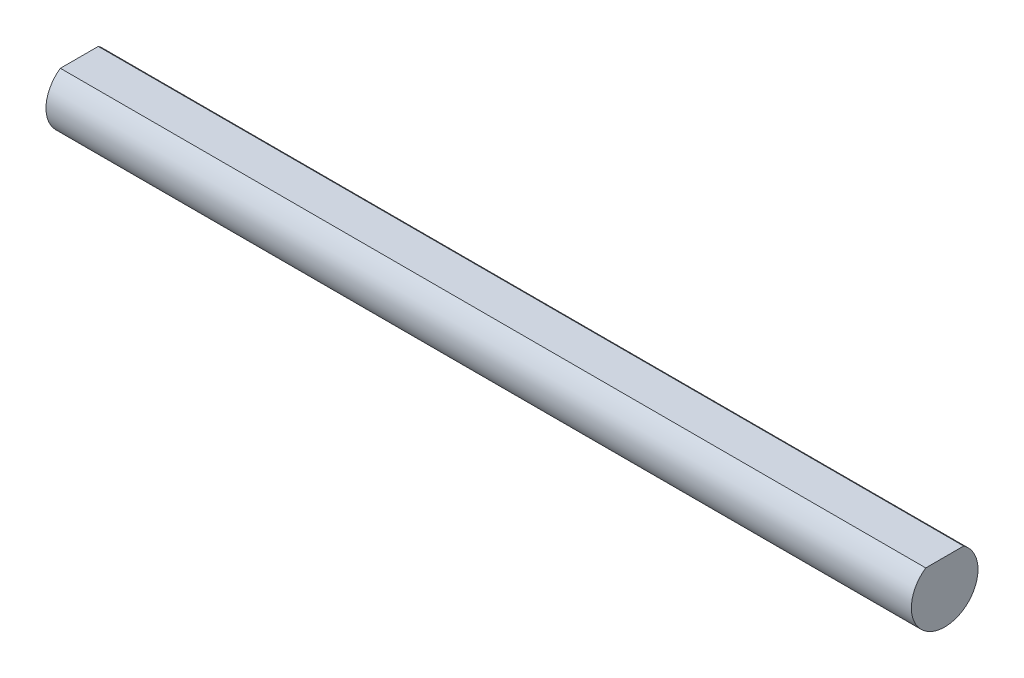
from build123d import *

# Parameters (mm, degrees)
BOSS_EXTRUDE1_DEPTH = 25


with BuildPart() as part:
    # Sketch1 → Boss-Extrude1 (new, symmetric)
    with BuildSketch(Plane(origin=(0, 0, 0), x_dir=(0, 0, -1), z_dir=(1, 0, 0))):
        with BuildLine():
            Line((1.095101338, 1.583154465), (-1.095101338, 1.583154465))
            ThreePointArc((-1.095101338, 1.583154465), (0, -1.925), (1.095101338, 1.583154465))
        make_face()
    extrude(amount=BOSS_EXTRUDE1_DEPTH, both=True)


solid = part.part
